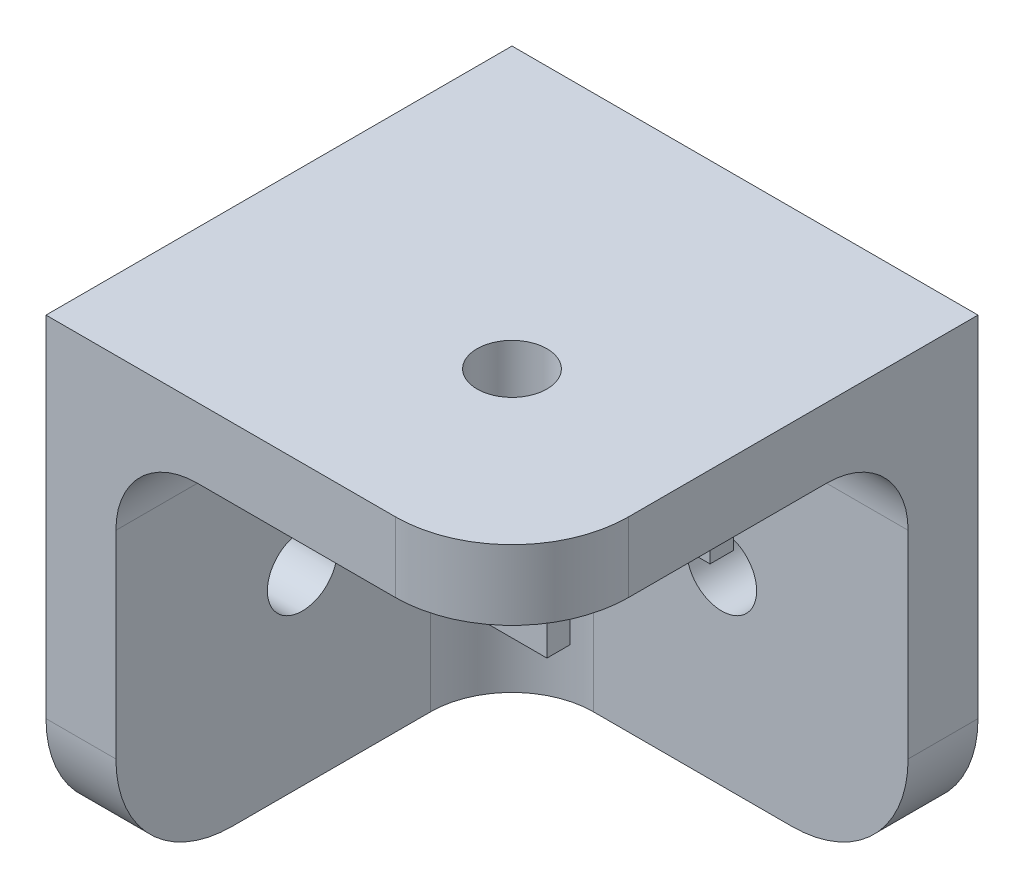
from build123d import *

# Parameters (mm, degrees)
SKETCH1_W           = 20
SKETCH1_H           = 20
BASE_DEPTH          = 10
SKETCH7_W           = 17
SKETCH7_H           = 17
BASECUT_DEPTH       = 17
FILLET1_R           = 3.5
SKETCH4_R           = 1.5
CUT_EXTRUDE3_DEPTH  = 25.494897428
SKETCH2_R           = 1.5
CUT_EXTRUDE1_DEPTH  = 25.494897428
SKETCH3_R           = 1.5
CUT_EXTRUDE2_DEPTH  = 25.494897428
BOSS_EXTRUDE1_DEPTH = 3
FILLET2_R           = 5


with BuildPart() as part:
    # Sketch1 → Base (new, symmetric)
    with BuildSketch(Plane.XY):
        Rectangle(SKETCH1_W, SKETCH1_H)
    extrude(amount=BASE_DEPTH, both=True)

    # Sketch7 → BaseCut (cut)
    with BuildSketch(Plane.XY.offset(10)):
        with Locations((1.5, -1.5)):
            Rectangle(SKETCH7_W, SKETCH7_H)
    extrude(amount=-BASECUT_DEPTH, mode=Mode.SUBTRACT)

    # Fillet1
    fillet1_edges = [part.edges().sort_by_distance(p)[0] for p in [
        (1.5, 7, -7),
        (-7, -1.5, -7),
        (-7, 7, 1.5),
    ]]
    fillet(fillet1_edges, radius=FILLET1_R)

    # Sketch4 → Cut-Extrude3 (cut, through all)
    with BuildSketch(Plane.XY.offset(10)):
        with Locations((2, -2)):
            Circle(SKETCH4_R)
    extrude(amount=-CUT_EXTRUDE3_DEPTH, mode=Mode.SUBTRACT)

    # Sketch2 → Cut-Extrude1 (cut, through all)
    with BuildSketch(Plane(origin=(10, 0, 0), x_dir=(0, 0, -1), z_dir=(1, 0, 0))):
        with Locations((-2, -2)):
            Circle(SKETCH2_R)
    extrude(amount=-CUT_EXTRUDE1_DEPTH, mode=Mode.SUBTRACT)

    # Sketch3 → Cut-Extrude2 (cut, through all)
    with BuildSketch(Plane(origin=(0, 10, 0), x_dir=(1, 0, 0), z_dir=(0, 1, 0))):
        with Locations((2, -2)):
            Circle(SKETCH3_R)
    extrude(amount=-CUT_EXTRUDE2_DEPTH, mode=Mode.SUBTRACT)

    # Sketch8 → Boss-Extrude1 (add)
    with BuildSketch(Plane.XZ.offset(-7)):
        Polygon((7.5, 5), (-0.5, 5), (-1.5, 4), (-1.5, 0), (-0.5, -1), (7.5, -1), (7.5, -2), (-0.914213562, -2), (-2.5, -0.414213562), (-2.5, 4.414213562), (-0.914213562, 6), (7.5, 6), align=None)
    extrude(amount=BOSS_EXTRUDE1_DEPTH)

    # Fillet2
    fillet2_edges = [part.edges().sort_by_distance(p)[0] for p in [
        (10, 8.5, 10),
        (10, -10, -8.5),
        (-8.5, -10, 10),
    ]]
    fillet(fillet2_edges, radius=FILLET2_R)


solid = part.part
